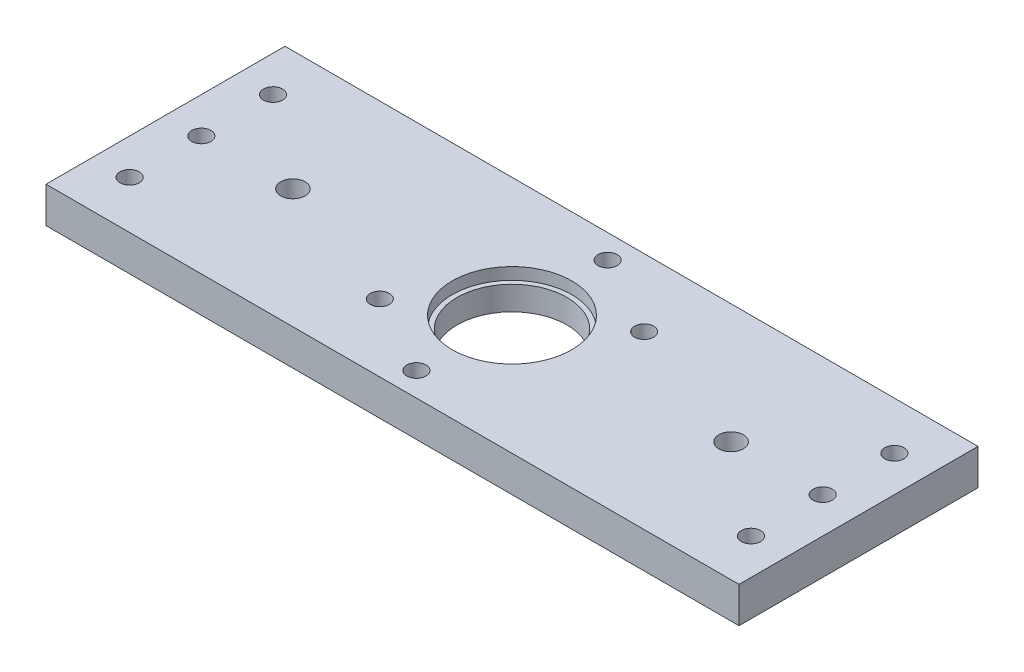
from build123d import *

# Parameters (mm, degrees)
SKETCH1_W                  = 184.15
SKETCH1_H                  = 63.5
BOSS_EXTRUDE1_DEPTH        = 9.525
SKETCH3_R                  = 14.605
CUT_EXTRUDE1_DEPTH         = 98.860072297
F_10_CLEARANCE_HOLE1_D     = 5.1054
F_6_5_6_5_DIAMETER_HOLE3_D = 6.5
SKETCH29_R                 = 15.875
CUT_EXTRUDE5_DEPTH         = 3.175
F_10_CLEARANCE_HOLE2_D     = 5.1054
SKETCH36_R                 = 2.54
CUT_EXTRUDE6_DEPTH         = 98.860072297


with BuildPart() as part:
    # Sketch1 → Boss-Extrude1 (new body)
    with BuildSketch(Plane(origin=(0, 0, 0), x_dir=(1, 0, 0), z_dir=(0, 1, 0))):
        Rectangle(SKETCH1_W, SKETCH1_H)
    extrude(amount=BOSS_EXTRUDE1_DEPTH)

    # Sketch3 → Cut-Extrude1 (cut, through all)
    with BuildSketch(Plane(origin=(0, 9.525, 0), x_dir=(1, 0, 0), z_dir=(0, 1, 0))):
        Circle(SKETCH3_R)
    extrude(amount=-CUT_EXTRUDE1_DEPTH, mode=Mode.SUBTRACT)

    # #10 Clearance Hole1 (through all)
    with Locations(Plane(origin=(0, 0, 0), x_dir=(-1, 0, 0), z_dir=(0, -1, 0))):
        with Locations((0, -25.4), (0, 25.4)):
            Hole(F_10_CLEARANCE_HOLE1_D / 2)

    # Ø6.5 (6.5) Diameter Hole3 (through all)
    with Locations(Plane(origin=(0, 0, 0), x_dir=(-1, 0, 0), z_dir=(0, -1, 0))):
        with Locations((58.208333333, 0), (-58.208333333, 0)):
            Hole(F_6_5_6_5_DIAMETER_HOLE3_D / 2)

    # Sketch29 → Cut-Extrude5 (cut)
    with BuildSketch(Plane(origin=(0, 9.525, 0), x_dir=(1, 0, 0), z_dir=(0, 1, 0))):
        Circle(SKETCH29_R)
    extrude(amount=-CUT_EXTRUDE5_DEPTH, mode=Mode.SUBTRACT)

    # #10 Clearance Hole2 (through all)
    with Locations(Plane(origin=(0, 9.525, 0), x_dir=(1, 0, 0), z_dir=(0, 1, 0))):
        with Locations((-82.55, 19.05), (-82.55, -19.05), (82.55, -19.05), (82.55, 19.05), (-82.55, 0), (82.55, 0)):
            Hole(F_10_CLEARANCE_HOLE2_D / 2)

    # Sketch36 → Cut-Extrude6 (cut, through all)
    with BuildSketch(Plane.XZ):
        with Locations((-21.329210467, 13.7922)):
            Circle(SKETCH36_R)
        with Locations((21.329210467, -13.7922)):
            Circle(SKETCH36_R)
    extrude(amount=-CUT_EXTRUDE6_DEPTH, mode=Mode.SUBTRACT)


solid = part.part
